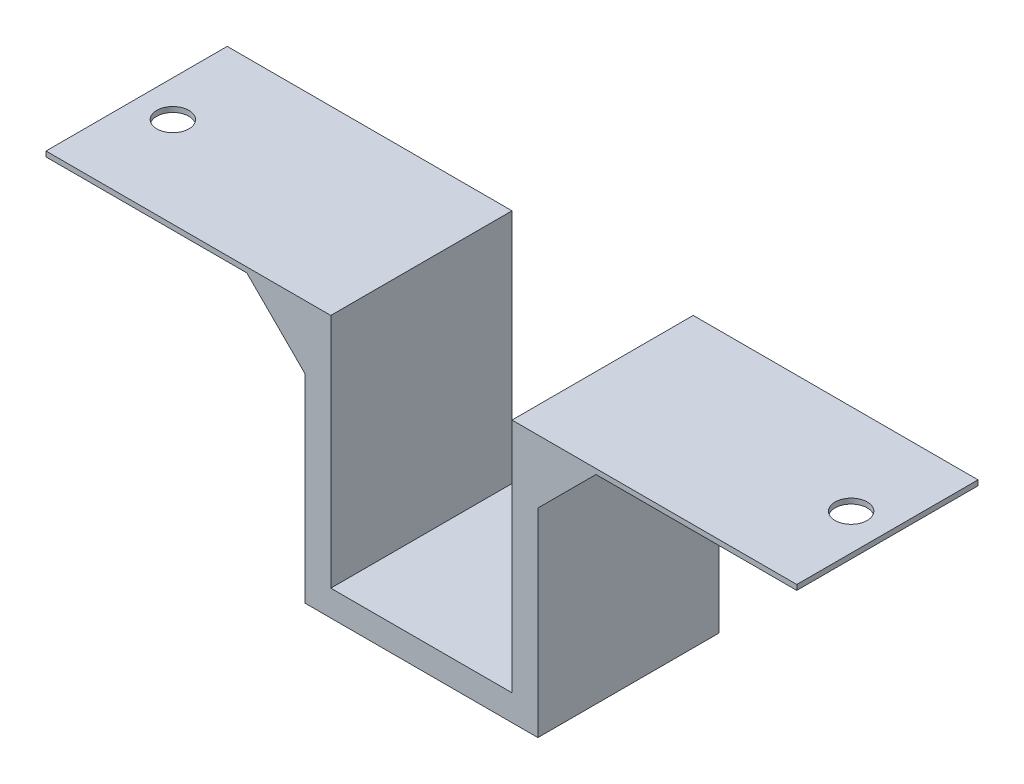
from build123d import *

# Parameters (mm, degrees)
BOSS_EXTRUDE1_DEPTH = 44.45
SKETCH2_R           = 3.937
CUT_EXTRUDE1_DEPTH  = 121.103292327


with BuildPart() as part:
    # Sketch1 → Boss-Extrude1 (new body)
    with BuildSketch(Plane.XY):
        Polygon((-22.225, 0), (22.225, 0), (22.225, 57.9374), (28.575, 57.9374), (92.075, 57.9374), (92.075, 56.6674), (42.818141465, 56.6674), (28.575, 42.424258535), (28.575, -6.35), (-28.575, -6.35), (-28.575, 42.424258535), (-42.818141465, 56.6674), (-92.075, 56.6674), (-92.075, 57.9374), (-28.575, 57.9374), (-22.225, 57.9374), align=None)
    extrude(amount=BOSS_EXTRUDE1_DEPTH)

    # Sketch2 → Cut-Extrude1 (cut, through all)
    with BuildSketch(Plane.XZ.offset(-56.6674)):
        with Locations((83.185, 22.225)):
            Circle(SKETCH2_R)
        with Locations((-83.185, 22.225)):
            Circle(SKETCH2_R)
    extrude(amount=-CUT_EXTRUDE1_DEPTH, mode=Mode.SUBTRACT)


solid = part.part
